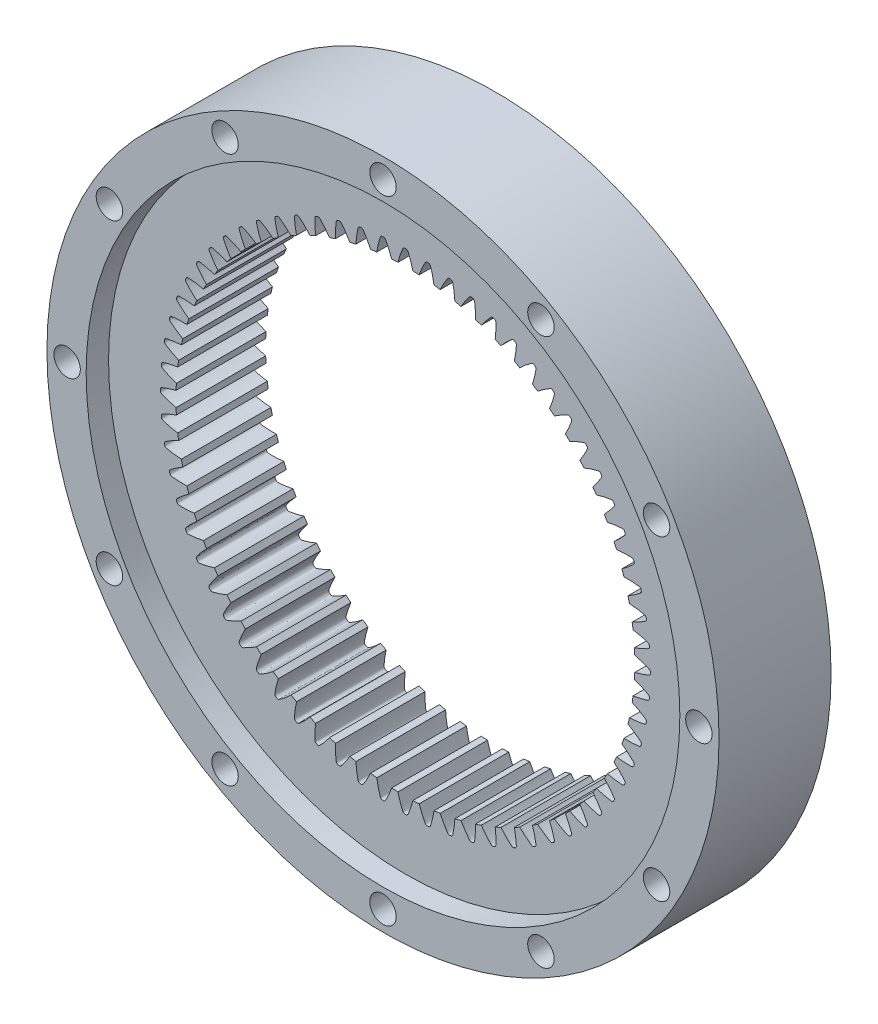
from build123d import *

# Parameters (mm, degrees)
SKETCHREVOLVERING_GEAR_FOLLOWER01_W       = 12.7
SKETCHREVOLVERING_GEAR_FOLLOWER01_H       = 12.088250957
TOOTHEXTRUDECUTRING_GEAR_FOLLOWER01_DEPTH = 6.35
PATTERNRING_GEAR_FOLLOWER01_COUNT         = 68
SKETCH1_R                                 = 33.655
CUT_EXTRUDE1_DEPTH                        = 2.54
SKETCH2_R                                 = 1.5
CUT_EXTRUDE2_DEPTH                        = 56.358016744


with BuildPart() as part:
    # SketchRevolveRing_Gear_Follower01 → Ring_Gear_Follower01 (revolve)
    with BuildSketch(Plane(origin=(0, 0, 0), x_dir=(0, 0, -1), z_dir=(1, 0, 0))):
        with Locations((0, 32.055874522)):
            Rectangle(SKETCHREVOLVERING_GEAR_FOLLOWER01_W, SKETCHREVOLVERING_GEAR_FOLLOWER01_H)
    revolve(axis=Axis((0, 0, 0), (0, 0, -1)))

    # SketchToothRing_Gear_Follower01 → ToothExtrudeCutRing_Gear_Follower01 (cut, symmetric)
    with BuildSketch(Plane.XY):
        with BuildLine():
            ThreePointArc((25.841581056, -0.877315347), (25.856469088, 0), (25.841581056, 0.877315347))
            add(Edge.make_bspline(
                [(25.841581056, 0.877315347), (25.93394438, 0.859095786), (26.077789137, 0.827156459), (26.275992391, 0.776518272), (26.441414177, 0.730363864), (26.617450855, 0.677021943), (26.803928954, 0.616121181), (27.000314944, 0.546698544), (27.207460689, 0.470242879), (27.431243142, 0.373706324), (27.608384889, 0.318508246), (27.703151856, 0.250803099), (27.72735641, 0.226635248), (27.747972016, 0.199379761), (27.76438083, 0.169398856), (27.780356819, 0.127186732), (27.785971447, 0.081461523), (27.785096671, 0.035556984), (27.785367745, 0), (27.785096671, -0.035556984), (27.785971447, -0.081461523), (27.780356819, -0.127186732), (27.76438083, -0.169398856), (27.747972016, -0.199379761), (27.72735641, -0.226635248), (27.703151856, -0.250803099), (27.608384889, -0.318508246), (27.431243142, -0.373706324), (27.207460689, -0.470242879), (27.000314944, -0.546698544), (26.803928954, -0.616121181), (26.617450855, -0.677021943), (26.441414177, -0.730363864), (26.275992391, -0.776518272), (26.077789137, -0.827156459), (25.93394438, -0.859095786), (25.841581056, -0.877315347)],
                knots=[0, 0, 0, 0, 0.06293672, 0.098485295, 0.136754012, 0.177742872, 0.221451875, 0.267881021, 0.31703031, 0.368899741, 0.431324234, 0.438915325, 0.446506415, 0.454097506, 0.461688597, 0.469279688, 0.484155493, 0.492077753, 0.5, 0.507922247, 0.515844507, 0.530720312, 0.538311403, 0.545902494, 0.553493585, 0.561084675, 0.568675766, 0.631100259, 0.68296969, 0.732118979, 0.778548125, 0.822257128, 0.863245988, 0.901514705, 0.93706328, 1, 1, 1, 1], degree=3))
        make_face()
    toothextrudecutring_gear_follower01 = extrude(amount=TOOTHEXTRUDECUTRING_GEAR_FOLLOWER01_DEPTH, both=True, mode=Mode.SUBTRACT)

    # PatternRing_Gear_Follower01: ToothExtrudeCutRing_Gear_Follower01 ×68 about axis
    patternring_gear_follower01_axis = Axis((0, 0, 55), (0, 0, -1))
    for i in range(1, PATTERNRING_GEAR_FOLLOWER01_COUNT):
        add(toothextrudecutring_gear_follower01.rotate(patternring_gear_follower01_axis, i * 360 / PATTERNRING_GEAR_FOLLOWER01_COUNT), mode=Mode.SUBTRACT)

    # Sketch1 → Cut-Extrude1 (cut)
    with BuildSketch(Plane.XY.offset(6.35)):
        Circle(SKETCH1_R)
    extrude(amount=-CUT_EXTRUDE1_DEPTH, mode=Mode.SUBTRACT)

    # Sketch2 → Cut-Extrude2 (cut, through all)
    with BuildSketch(Plane.XY.offset(6.35)):
        with Locations((0, 35.814)):
            Circle(SKETCH2_R)
        with Locations((17.907, 31.015833811)):
            Circle(SKETCH2_R)
        with Locations((31.015833811, 17.907)):
            Circle(SKETCH2_R)
        with Locations((35.814, 0)):
            Circle(SKETCH2_R)
        with Locations((31.015833811, -17.907)):
            Circle(SKETCH2_R)
        with Locations((17.907, -31.015833811)):
            Circle(SKETCH2_R)
        with Locations((0, -35.814)):
            Circle(SKETCH2_R)
        with Locations((-17.907, -31.015833811)):
            Circle(SKETCH2_R)
        with Locations((-31.015833811, -17.907)):
            Circle(SKETCH2_R)
        with Locations((-35.814, 0)):
            Circle(SKETCH2_R)
        with Locations((-31.015833811, 17.907)):
            Circle(SKETCH2_R)
        with Locations((-17.907, 31.015833811)):
            Circle(SKETCH2_R)
    extrude(amount=-CUT_EXTRUDE2_DEPTH, mode=Mode.SUBTRACT)


solid = part.part
